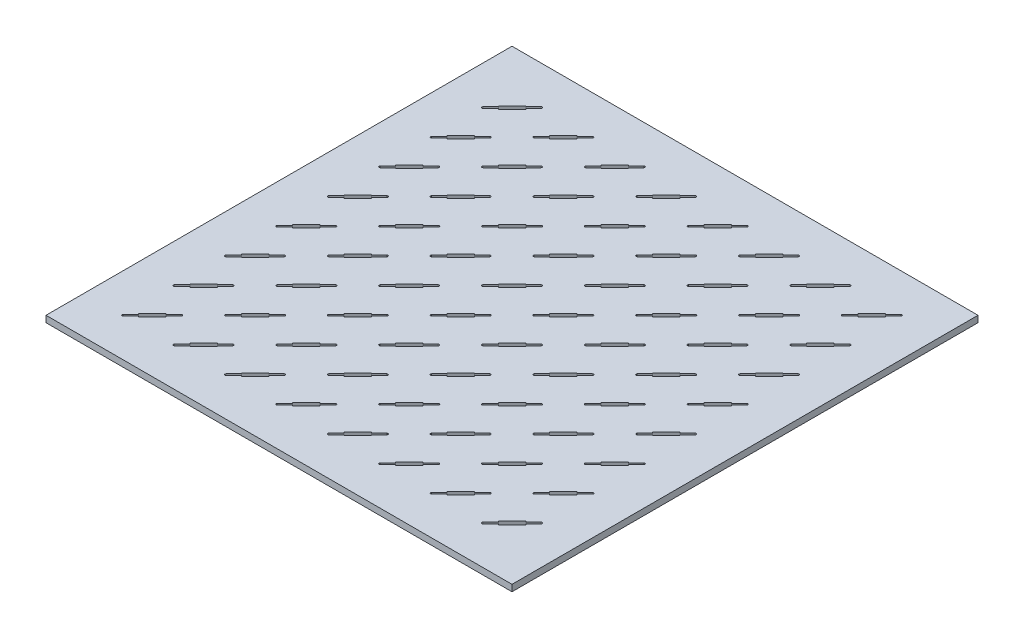
from build123d import *

# Parameters (mm, degrees)
SKETCH1_W           = 431.8
SKETCH1_H           = 431.8
BOSS_EXTRUDE1_DEPTH = 6
CUT_EXTRUDE1_DEPTH  = 4
SKETCH5_R           = 1
CUT_EXTRUDE3_DEPTH  = 611.68689195


with BuildPart() as part:
    # Sketch1 → Boss-Extrude1 (new body)
    with BuildSketch(Plane(origin=(0, 0, 0), x_dir=(1, 0, 0), z_dir=(0, 1, 0))):
        with Locations((215.9, 215.9)):
            Rectangle(SKETCH1_W, SKETCH1_H)
    extrude(amount=BOSS_EXTRUDE1_DEPTH)

    # Sketch2 → Cut-Extrude1 (cut)
    with BuildSketch(Plane(origin=(0, 6, 0), x_dir=(1, 0, 0), z_dir=(0, 1, 0))):
        Polygon((42.140753045, 43.554966607), (35.069685233, 36.483898795), (36.483898795, 35.069685233), (43.554966607, 42.140753045), (44.262073388, 41.433646263), (56.98999545, 54.161568325), (56.282888668, 54.868675106), (63.35395648, 61.939742918), (61.939742918, 63.35395648), (54.868675106, 56.282888668), (54.161568325, 56.98999545), (41.433646263, 44.262073388), align=None)
        Polygon((56.98999545, 101.791568325), (56.282888668, 102.498675106), (63.35395648, 109.569742918), (61.939742918, 110.98395648), (54.868675106, 103.912888668), (54.161568325, 104.61999545), (41.433646263, 91.892073388), (42.140753045, 91.184966607), (35.069685233, 84.113898795), (36.483898795, 82.699685233), (43.554966607, 89.770753045), (44.262073388, 89.063646263), align=None)
        Polygon((56.98999545, 149.421568325), (56.282888668, 150.128675106), (63.35395648, 157.199742918), (61.939742918, 158.61395648), (54.868675106, 151.542888668), (54.161568325, 152.24999545), (41.433646263, 139.522073388), (42.140753045, 138.814966607), (35.069685233, 131.743898795), (36.483898795, 130.329685233), (43.554966607, 137.400753045), (44.262073388, 136.693646263), align=None)
        Polygon((56.98999545, 197.051568325), (56.282888668, 197.758675106), (63.35395648, 204.829742918), (61.939742918, 206.24395648), (54.868675106, 199.172888668), (54.161568325, 199.87999545), (41.433646263, 187.152073388), (42.140753045, 186.444966607), (35.069685233, 179.373898795), (36.483898795, 177.959685233), (43.554966607, 185.030753045), (44.262073388, 184.323646263), align=None)
        Polygon((56.98999545, 244.681568325), (56.282888668, 245.388675106), (63.35395648, 252.459742918), (61.939742918, 253.87395648), (54.868675106, 246.802888668), (54.161568325, 247.50999545), (41.433646263, 234.782073388), (42.140753045, 234.074966607), (35.069685233, 227.003898795), (36.483898795, 225.589685233), (43.554966607, 232.660753045), (44.262073388, 231.953646263), align=None)
        Polygon((56.98999545, 292.311568325), (56.282888668, 293.018675106), (63.35395648, 300.089742918), (61.939742918, 301.50395648), (54.868675106, 294.432888668), (54.161568325, 295.13999545), (41.433646263, 282.412073388), (42.140753045, 281.704966607), (35.069685233, 274.633898795), (36.483898795, 273.219685233), (43.554966607, 280.290753045), (44.262073388, 279.583646263), align=None)
        Polygon((56.98999545, 339.941568325), (56.282888668, 340.648675106), (63.35395648, 347.719742918), (61.939742918, 349.13395648), (54.868675106, 342.062888668), (54.161568325, 342.76999545), (41.433646263, 330.042073388), (42.140753045, 329.334966607), (35.069685233, 322.263898795), (36.483898795, 320.849685233), (43.554966607, 327.920753045), (44.262073388, 327.213646263), align=None)
        Polygon((56.98999545, 387.571568325), (56.282888668, 388.278675106), (63.35395648, 395.349742918), (61.939742918, 396.76395648), (54.868675106, 389.692888668), (54.161568325, 390.39999545), (41.433646263, 377.672073388), (42.140753045, 376.964966607), (35.069685233, 369.893898795), (36.483898795, 368.479685233), (43.554966607, 375.550753045), (44.262073388, 374.843646263), align=None)
        Polygon((104.61999545, 101.791568325), (103.912888668, 102.498675106), (110.98395648, 109.569742918), (109.569742918, 110.98395648), (102.498675106, 103.912888668), (101.791568325, 104.61999545), (89.063646263, 91.892073388), (89.770753045, 91.184966607), (82.699685233, 84.113898795), (84.113898795, 82.699685233), (91.184966607, 89.770753045), (91.892073388, 89.063646263), align=None)
        Polygon((104.61999545, 149.421568325), (103.912888668, 150.128675106), (110.98395648, 157.199742918), (109.569742918, 158.61395648), (102.498675106, 151.542888668), (101.791568325, 152.24999545), (89.063646263, 139.522073388), (89.770753045, 138.814966607), (82.699685233, 131.743898795), (84.113898795, 130.329685233), (91.184966607, 137.400753045), (91.892073388, 136.693646263), align=None)
        Polygon((104.61999545, 197.051568325), (103.912888668, 197.758675106), (110.98395648, 204.829742918), (109.569742918, 206.24395648), (102.498675106, 199.172888668), (101.791568325, 199.87999545), (89.063646263, 187.152073388), (89.770753045, 186.444966607), (82.699685233, 179.373898795), (84.113898795, 177.959685233), (91.184966607, 185.030753045), (91.892073388, 184.323646263), align=None)
        Polygon((104.61999545, 244.681568325), (103.912888668, 245.388675106), (110.98395648, 252.459742918), (109.569742918, 253.87395648), (102.498675106, 246.802888668), (101.791568325, 247.50999545), (89.063646263, 234.782073388), (89.770753045, 234.074966607), (82.699685233, 227.003898795), (84.113898795, 225.589685233), (91.184966607, 232.660753045), (91.892073388, 231.953646263), align=None)
        Polygon((104.61999545, 292.311568325), (103.912888668, 293.018675106), (110.98395648, 300.089742918), (109.569742918, 301.50395648), (102.498675106, 294.432888668), (101.791568325, 295.13999545), (89.063646263, 282.412073388), (89.770753045, 281.704966607), (82.699685233, 274.633898795), (84.113898795, 273.219685233), (91.184966607, 280.290753045), (91.892073388, 279.583646263), align=None)
        Polygon((104.61999545, 339.941568325), (103.912888668, 340.648675106), (110.98395648, 347.719742918), (109.569742918, 349.13395648), (102.498675106, 342.062888668), (101.791568325, 342.76999545), (89.063646263, 330.042073388), (89.770753045, 329.334966607), (82.699685233, 322.263898795), (84.113898795, 320.849685233), (91.184966607, 327.920753045), (91.892073388, 327.213646263), align=None)
        Polygon((104.61999545, 387.571568325), (103.912888668, 388.278675106), (110.98395648, 395.349742918), (109.569742918, 396.76395648), (102.498675106, 389.692888668), (101.791568325, 390.39999545), (89.063646263, 377.672073388), (89.770753045, 376.964966607), (82.699685233, 369.893898795), (84.113898795, 368.479685233), (91.184966607, 375.550753045), (91.892073388, 374.843646263), align=None)
        Polygon((152.24999545, 101.791568325), (151.542888668, 102.498675106), (158.61395648, 109.569742918), (157.199742918, 110.98395648), (150.128675106, 103.912888668), (149.421568325, 104.61999545), (136.693646263, 91.892073388), (137.400753045, 91.184966607), (130.329685233, 84.113898795), (131.743898795, 82.699685233), (138.814966607, 89.770753045), (139.522073388, 89.063646263), align=None)
        Polygon((152.24999545, 149.421568325), (151.542888668, 150.128675106), (158.61395648, 157.199742918), (157.199742918, 158.61395648), (150.128675106, 151.542888668), (149.421568325, 152.24999545), (136.693646263, 139.522073388), (137.400753045, 138.814966607), (130.329685233, 131.743898795), (131.743898795, 130.329685233), (138.814966607, 137.400753045), (139.522073388, 136.693646263), align=None)
        Polygon((152.24999545, 197.051568325), (151.542888668, 197.758675106), (158.61395648, 204.829742918), (157.199742918, 206.24395648), (150.128675106, 199.172888668), (149.421568325, 199.87999545), (136.693646263, 187.152073388), (137.400753045, 186.444966607), (130.329685233, 179.373898795), (131.743898795, 177.959685233), (138.814966607, 185.030753045), (139.522073388, 184.323646263), align=None)
        Polygon((152.24999545, 244.681568325), (151.542888668, 245.388675106), (158.61395648, 252.459742918), (157.199742918, 253.87395648), (150.128675106, 246.802888668), (149.421568325, 247.50999545), (136.693646263, 234.782073388), (137.400753045, 234.074966607), (130.329685233, 227.003898795), (131.743898795, 225.589685233), (138.814966607, 232.660753045), (139.522073388, 231.953646263), align=None)
        Polygon((152.24999545, 292.311568325), (151.542888668, 293.018675106), (158.61395648, 300.089742918), (157.199742918, 301.50395648), (150.128675106, 294.432888668), (149.421568325, 295.13999545), (136.693646263, 282.412073388), (137.400753045, 281.704966607), (130.329685233, 274.633898795), (131.743898795, 273.219685233), (138.814966607, 280.290753045), (139.522073388, 279.583646263), align=None)
        Polygon((152.24999545, 339.941568325), (151.542888668, 340.648675106), (158.61395648, 347.719742918), (157.199742918, 349.13395648), (150.128675106, 342.062888668), (149.421568325, 342.76999545), (136.693646263, 330.042073388), (137.400753045, 329.334966607), (130.329685233, 322.263898795), (131.743898795, 320.849685233), (138.814966607, 327.920753045), (139.522073388, 327.213646263), align=None)
        Polygon((152.24999545, 387.571568325), (151.542888668, 388.278675106), (158.61395648, 395.349742918), (157.199742918, 396.76395648), (150.128675106, 389.692888668), (149.421568325, 390.39999545), (136.693646263, 377.672073388), (137.400753045, 376.964966607), (130.329685233, 369.893898795), (131.743898795, 368.479685233), (138.814966607, 375.550753045), (139.522073388, 374.843646263), align=None)
        Polygon((199.87999545, 101.791568325), (199.172888668, 102.498675106), (206.24395648, 109.569742918), (204.829742918, 110.98395648), (197.758675106, 103.912888668), (197.051568325, 104.61999545), (184.323646263, 91.892073388), (185.030753045, 91.184966607), (177.959685233, 84.113898795), (179.373898795, 82.699685233), (186.444966607, 89.770753045), (187.152073388, 89.063646263), align=None)
        Polygon((199.87999545, 149.421568325), (199.172888668, 150.128675106), (206.24395648, 157.199742918), (204.829742918, 158.61395648), (197.758675106, 151.542888668), (197.051568325, 152.24999545), (184.323646263, 139.522073388), (185.030753045, 138.814966607), (177.959685233, 131.743898795), (179.373898795, 130.329685233), (186.444966607, 137.400753045), (187.152073388, 136.693646263), align=None)
        Polygon((199.87999545, 197.051568325), (199.172888668, 197.758675106), (206.24395648, 204.829742918), (204.829742918, 206.24395648), (197.758675106, 199.172888668), (197.051568325, 199.87999545), (184.323646263, 187.152073388), (185.030753045, 186.444966607), (177.959685233, 179.373898795), (179.373898795, 177.959685233), (186.444966607, 185.030753045), (187.152073388, 184.323646263), align=None)
        Polygon((199.87999545, 244.681568325), (199.172888668, 245.388675106), (206.24395648, 252.459742918), (204.829742918, 253.87395648), (197.758675106, 246.802888668), (197.051568325, 247.50999545), (184.323646263, 234.782073388), (185.030753045, 234.074966607), (177.959685233, 227.003898795), (179.373898795, 225.589685233), (186.444966607, 232.660753045), (187.152073388, 231.953646263), align=None)
        Polygon((199.87999545, 292.311568325), (199.172888668, 293.018675106), (206.24395648, 300.089742918), (204.829742918, 301.50395648), (197.758675106, 294.432888668), (197.051568325, 295.13999545), (184.323646263, 282.412073388), (185.030753045, 281.704966607), (177.959685233, 274.633898795), (179.373898795, 273.219685233), (186.444966607, 280.290753045), (187.152073388, 279.583646263), align=None)
        Polygon((199.87999545, 339.941568325), (199.172888668, 340.648675106), (206.24395648, 347.719742918), (204.829742918, 349.13395648), (197.758675106, 342.062888668), (197.051568325, 342.76999545), (184.323646263, 330.042073388), (185.030753045, 329.334966607), (177.959685233, 322.263898795), (179.373898795, 320.849685233), (186.444966607, 327.920753045), (187.152073388, 327.213646263), align=None)
        Polygon((199.87999545, 387.571568325), (199.172888668, 388.278675106), (206.24395648, 395.349742918), (204.829742918, 396.76395648), (197.758675106, 389.692888668), (197.051568325, 390.39999545), (184.323646263, 377.672073388), (185.030753045, 376.964966607), (177.959685233, 369.893898795), (179.373898795, 368.479685233), (186.444966607, 375.550753045), (187.152073388, 374.843646263), align=None)
        Polygon((247.50999545, 101.791568325), (246.802888668, 102.498675106), (253.87395648, 109.569742918), (252.459742918, 110.98395648), (245.388675106, 103.912888668), (244.681568325, 104.61999545), (231.953646263, 91.892073388), (232.660753045, 91.184966607), (225.589685233, 84.113898795), (227.003898795, 82.699685233), (234.074966607, 89.770753045), (234.782073388, 89.063646263), align=None)
        Polygon((247.50999545, 149.421568325), (246.802888668, 150.128675106), (253.87395648, 157.199742918), (252.459742918, 158.61395648), (245.388675106, 151.542888668), (244.681568325, 152.24999545), (231.953646263, 139.522073388), (232.660753045, 138.814966607), (225.589685233, 131.743898795), (227.003898795, 130.329685233), (234.074966607, 137.400753045), (234.782073388, 136.693646263), align=None)
        Polygon((247.50999545, 197.051568325), (246.802888668, 197.758675106), (253.87395648, 204.829742918), (252.459742918, 206.24395648), (245.388675106, 199.172888668), (244.681568325, 199.87999545), (231.953646263, 187.152073388), (232.660753045, 186.444966607), (225.589685233, 179.373898795), (227.003898795, 177.959685233), (234.074966607, 185.030753045), (234.782073388, 184.323646263), align=None)
        Polygon((247.50999545, 244.681568325), (246.802888668, 245.388675106), (253.87395648, 252.459742918), (252.459742918, 253.87395648), (245.388675106, 246.802888668), (244.681568325, 247.50999545), (231.953646263, 234.782073388), (232.660753045, 234.074966607), (225.589685233, 227.003898795), (227.003898795, 225.589685233), (234.074966607, 232.660753045), (234.782073388, 231.953646263), align=None)
        Polygon((247.50999545, 292.311568325), (246.802888668, 293.018675106), (253.87395648, 300.089742918), (252.459742918, 301.50395648), (245.388675106, 294.432888668), (244.681568325, 295.13999545), (231.953646263, 282.412073388), (232.660753045, 281.704966607), (225.589685233, 274.633898795), (227.003898795, 273.219685233), (234.074966607, 280.290753045), (234.782073388, 279.583646263), align=None)
        Polygon((247.50999545, 339.941568325), (246.802888668, 340.648675106), (253.87395648, 347.719742918), (252.459742918, 349.13395648), (245.388675106, 342.062888668), (244.681568325, 342.76999545), (231.953646263, 330.042073388), (232.660753045, 329.334966607), (225.589685233, 322.263898795), (227.003898795, 320.849685233), (234.074966607, 327.920753045), (234.782073388, 327.213646263), align=None)
        Polygon((247.50999545, 387.571568325), (246.802888668, 388.278675106), (253.87395648, 395.349742918), (252.459742918, 396.76395648), (245.388675106, 389.692888668), (244.681568325, 390.39999545), (231.953646263, 377.672073388), (232.660753045, 376.964966607), (225.589685233, 369.893898795), (227.003898795, 368.479685233), (234.074966607, 375.550753045), (234.782073388, 374.843646263), align=None)
        Polygon((295.13999545, 101.791568325), (294.432888668, 102.498675106), (301.50395648, 109.569742918), (300.089742918, 110.98395648), (293.018675106, 103.912888668), (292.311568325, 104.61999545), (279.583646263, 91.892073388), (280.290753045, 91.184966607), (273.219685233, 84.113898795), (274.633898795, 82.699685233), (281.704966607, 89.770753045), (282.412073388, 89.063646263), align=None)
        Polygon((295.13999545, 149.421568325), (294.432888668, 150.128675106), (301.50395648, 157.199742918), (300.089742918, 158.61395648), (293.018675106, 151.542888668), (292.311568325, 152.24999545), (279.583646263, 139.522073388), (280.290753045, 138.814966607), (273.219685233, 131.743898795), (274.633898795, 130.329685233), (281.704966607, 137.400753045), (282.412073388, 136.693646263), align=None)
        Polygon((295.13999545, 197.051568325), (294.432888668, 197.758675106), (301.50395648, 204.829742918), (300.089742918, 206.24395648), (293.018675106, 199.172888668), (292.311568325, 199.87999545), (279.583646263, 187.152073388), (280.290753045, 186.444966607), (273.219685233, 179.373898795), (274.633898795, 177.959685233), (281.704966607, 185.030753045), (282.412073388, 184.323646263), align=None)
        Polygon((295.13999545, 244.681568325), (294.432888668, 245.388675106), (301.50395648, 252.459742918), (300.089742918, 253.87395648), (293.018675106, 246.802888668), (292.311568325, 247.50999545), (279.583646263, 234.782073388), (280.290753045, 234.074966607), (273.219685233, 227.003898795), (274.633898795, 225.589685233), (281.704966607, 232.660753045), (282.412073388, 231.953646263), align=None)
        Polygon((295.13999545, 292.311568325), (294.432888668, 293.018675106), (301.50395648, 300.089742918), (300.089742918, 301.50395648), (293.018675106, 294.432888668), (292.311568325, 295.13999545), (279.583646263, 282.412073388), (280.290753045, 281.704966607), (273.219685233, 274.633898795), (274.633898795, 273.219685233), (281.704966607, 280.290753045), (282.412073388, 279.583646263), align=None)
        Polygon((295.13999545, 339.941568325), (294.432888668, 340.648675106), (301.50395648, 347.719742918), (300.089742918, 349.13395648), (293.018675106, 342.062888668), (292.311568325, 342.76999545), (279.583646263, 330.042073388), (280.290753045, 329.334966607), (273.219685233, 322.263898795), (274.633898795, 320.849685233), (281.704966607, 327.920753045), (282.412073388, 327.213646263), align=None)
        Polygon((295.13999545, 387.571568325), (294.432888668, 388.278675106), (301.50395648, 395.349742918), (300.089742918, 396.76395648), (293.018675106, 389.692888668), (292.311568325, 390.39999545), (279.583646263, 377.672073388), (280.290753045, 376.964966607), (273.219685233, 369.893898795), (274.633898795, 368.479685233), (281.704966607, 375.550753045), (282.412073388, 374.843646263), align=None)
        Polygon((342.76999545, 101.791568325), (342.062888668, 102.498675106), (349.13395648, 109.569742918), (347.719742918, 110.98395648), (340.648675106, 103.912888668), (339.941568325, 104.61999545), (327.213646263, 91.892073388), (327.920753045, 91.184966607), (320.849685233, 84.113898795), (322.263898795, 82.699685233), (329.334966607, 89.770753045), (330.042073388, 89.063646263), align=None)
        Polygon((342.76999545, 149.421568325), (342.062888668, 150.128675106), (349.13395648, 157.199742918), (347.719742918, 158.61395648), (340.648675106, 151.542888668), (339.941568325, 152.24999545), (327.213646263, 139.522073388), (327.920753045, 138.814966607), (320.849685233, 131.743898795), (322.263898795, 130.329685233), (329.334966607, 137.400753045), (330.042073388, 136.693646263), align=None)
        Polygon((342.76999545, 197.051568325), (342.062888668, 197.758675106), (349.13395648, 204.829742918), (347.719742918, 206.24395648), (340.648675106, 199.172888668), (339.941568325, 199.87999545), (327.213646263, 187.152073388), (327.920753045, 186.444966607), (320.849685233, 179.373898795), (322.263898795, 177.959685233), (329.334966607, 185.030753045), (330.042073388, 184.323646263), align=None)
        Polygon((342.76999545, 244.681568325), (342.062888668, 245.388675106), (349.13395648, 252.459742918), (347.719742918, 253.87395648), (340.648675106, 246.802888668), (339.941568325, 247.50999545), (327.213646263, 234.782073388), (327.920753045, 234.074966607), (320.849685233, 227.003898795), (322.263898795, 225.589685233), (329.334966607, 232.660753045), (330.042073388, 231.953646263), align=None)
        Polygon((342.76999545, 292.311568325), (342.062888668, 293.018675106), (349.13395648, 300.089742918), (347.719742918, 301.50395648), (340.648675106, 294.432888668), (339.941568325, 295.13999545), (327.213646263, 282.412073388), (327.920753045, 281.704966607), (320.849685233, 274.633898795), (322.263898795, 273.219685233), (329.334966607, 280.290753045), (330.042073388, 279.583646263), align=None)
        Polygon((342.76999545, 339.941568325), (342.062888668, 340.648675106), (349.13395648, 347.719742918), (347.719742918, 349.13395648), (340.648675106, 342.062888668), (339.941568325, 342.76999545), (327.213646263, 330.042073388), (327.920753045, 329.334966607), (320.849685233, 322.263898795), (322.263898795, 320.849685233), (329.334966607, 327.920753045), (330.042073388, 327.213646263), align=None)
        Polygon((342.76999545, 387.571568325), (342.062888668, 388.278675106), (349.13395648, 395.349742918), (347.719742918, 396.76395648), (340.648675106, 389.692888668), (339.941568325, 390.39999545), (327.213646263, 377.672073388), (327.920753045, 376.964966607), (320.849685233, 369.893898795), (322.263898795, 368.479685233), (329.334966607, 375.550753045), (330.042073388, 374.843646263), align=None)
        Polygon((390.39999545, 101.791568325), (389.692888668, 102.498675106), (396.76395648, 109.569742918), (395.349742918, 110.98395648), (388.278675106, 103.912888668), (387.571568325, 104.61999545), (374.843646263, 91.892073388), (375.550753045, 91.184966607), (368.479685233, 84.113898795), (369.893898795, 82.699685233), (376.964966607, 89.770753045), (377.672073388, 89.063646263), align=None)
        Polygon((390.39999545, 149.421568325), (389.692888668, 150.128675106), (396.76395648, 157.199742918), (395.349742918, 158.61395648), (388.278675106, 151.542888668), (387.571568325, 152.24999545), (374.843646263, 139.522073388), (375.550753045, 138.814966607), (368.479685233, 131.743898795), (369.893898795, 130.329685233), (376.964966607, 137.400753045), (377.672073388, 136.693646263), align=None)
        Polygon((390.39999545, 197.051568325), (389.692888668, 197.758675106), (396.76395648, 204.829742918), (395.349742918, 206.24395648), (388.278675106, 199.172888668), (387.571568325, 199.87999545), (374.843646263, 187.152073388), (375.550753045, 186.444966607), (368.479685233, 179.373898795), (369.893898795, 177.959685233), (376.964966607, 185.030753045), (377.672073388, 184.323646263), align=None)
        Polygon((390.39999545, 244.681568325), (389.692888668, 245.388675106), (396.76395648, 252.459742918), (395.349742918, 253.87395648), (388.278675106, 246.802888668), (387.571568325, 247.50999545), (374.843646263, 234.782073388), (375.550753045, 234.074966607), (368.479685233, 227.003898795), (369.893898795, 225.589685233), (376.964966607, 232.660753045), (377.672073388, 231.953646263), align=None)
        Polygon((390.39999545, 292.311568325), (389.692888668, 293.018675106), (396.76395648, 300.089742918), (395.349742918, 301.50395648), (388.278675106, 294.432888668), (387.571568325, 295.13999545), (374.843646263, 282.412073388), (375.550753045, 281.704966607), (368.479685233, 274.633898795), (369.893898795, 273.219685233), (376.964966607, 280.290753045), (377.672073388, 279.583646263), align=None)
        Polygon((390.39999545, 339.941568325), (389.692888668, 340.648675106), (396.76395648, 347.719742918), (395.349742918, 349.13395648), (388.278675106, 342.062888668), (387.571568325, 342.76999545), (374.843646263, 330.042073388), (375.550753045, 329.334966607), (368.479685233, 322.263898795), (369.893898795, 320.849685233), (376.964966607, 327.920753045), (377.672073388, 327.213646263), align=None)
        Polygon((390.39999545, 387.571568325), (389.692888668, 388.278675106), (396.76395648, 395.349742918), (395.349742918, 396.76395648), (388.278675106, 389.692888668), (387.571568325, 390.39999545), (374.843646263, 377.672073388), (375.550753045, 376.964966607), (368.479685233, 369.893898795), (369.893898795, 368.479685233), (376.964966607, 375.550753045), (377.672073388, 374.843646263), align=None)
        Polygon((104.61999545, 54.161568325), (103.912888668, 54.868675106), (110.98395648, 61.939742918), (109.569742918, 63.35395648), (102.498675106, 56.282888668), (101.791568325, 56.98999545), (89.063646263, 44.262073388), (89.770753045, 43.554966607), (82.699685233, 36.483898795), (84.113898795, 35.069685233), (91.184966607, 42.140753045), (91.892073388, 41.433646263), align=None)
        Polygon((152.24999545, 54.161568325), (151.542888668, 54.868675106), (158.61395648, 61.939742918), (157.199742918, 63.35395648), (150.128675106, 56.282888668), (149.421568325, 56.98999545), (136.693646263, 44.262073388), (137.400753045, 43.554966607), (130.329685233, 36.483898795), (131.743898795, 35.069685233), (138.814966607, 42.140753045), (139.522073388, 41.433646263), align=None)
        Polygon((199.87999545, 54.161568325), (199.172888668, 54.868675106), (206.24395648, 61.939742918), (204.829742918, 63.35395648), (197.758675106, 56.282888668), (197.051568325, 56.98999545), (184.323646263, 44.262073388), (185.030753045, 43.554966607), (177.959685233, 36.483898795), (179.373898795, 35.069685233), (186.444966607, 42.140753045), (187.152073388, 41.433646263), align=None)
        Polygon((247.50999545, 54.161568325), (246.802888668, 54.868675106), (253.87395648, 61.939742918), (252.459742918, 63.35395648), (245.388675106, 56.282888668), (244.681568325, 56.98999545), (231.953646263, 44.262073388), (232.660753045, 43.554966607), (225.589685233, 36.483898795), (227.003898795, 35.069685233), (234.074966607, 42.140753045), (234.782073388, 41.433646263), align=None)
        Polygon((295.13999545, 54.161568325), (294.432888668, 54.868675106), (301.50395648, 61.939742918), (300.089742918, 63.35395648), (293.018675106, 56.282888668), (292.311568325, 56.98999545), (279.583646263, 44.262073388), (280.290753045, 43.554966607), (273.219685233, 36.483898795), (274.633898795, 35.069685233), (281.704966607, 42.140753045), (282.412073388, 41.433646263), align=None)
        Polygon((342.76999545, 54.161568325), (342.062888668, 54.868675106), (349.13395648, 61.939742918), (347.719742918, 63.35395648), (340.648675106, 56.282888668), (339.941568325, 56.98999545), (327.213646263, 44.262073388), (327.920753045, 43.554966607), (320.849685233, 36.483898795), (322.263898795, 35.069685233), (329.334966607, 42.140753045), (330.042073388, 41.433646263), align=None)
        Polygon((390.39999545, 54.161568325), (389.692888668, 54.868675106), (396.76395648, 61.939742918), (395.349742918, 63.35395648), (388.278675106, 56.282888668), (387.571568325, 56.98999545), (374.843646263, 44.262073388), (375.550753045, 43.554966607), (368.479685233, 36.483898795), (369.893898795, 35.069685233), (376.964966607, 42.140753045), (377.672073388, 41.433646263), align=None)
    extrude(amount=-CUT_EXTRUDE1_DEPTH, mode=Mode.SUBTRACT)

    # Sketch5 → Cut-Extrude3 (cut, through all)
    with BuildSketch(Plane(origin=(0, 6, 0), x_dir=(1, 0, 0), z_dir=(0, 1, 0))):
        with Locations((35.776792014, 35.776792014)):
            Circle(SKETCH5_R)
        with Locations((62.646849699, 62.646849699)):
            Circle(SKETCH5_R)
        with Locations((35.776792014, 83.406792014)):
            Circle(SKETCH5_R)
        with Locations((62.646849699, 110.276849699)):
            Circle(SKETCH5_R)
        with Locations((35.776792014, 131.036792014)):
            Circle(SKETCH5_R)
        with Locations((62.646849699, 157.906849699)):
            Circle(SKETCH5_R)
        with Locations((35.776792014, 178.666792014)):
            Circle(SKETCH5_R)
        with Locations((62.646849699, 205.536849699)):
            Circle(SKETCH5_R)
        with Locations((35.776792014, 226.296792014)):
            Circle(SKETCH5_R)
        with Locations((62.646849699, 253.166849699)):
            Circle(SKETCH5_R)
        with Locations((35.776792014, 273.926792014)):
            Circle(SKETCH5_R)
        with Locations((62.646849699, 300.796849699)):
            Circle(SKETCH5_R)
        with Locations((35.776792014, 321.556792014)):
            Circle(SKETCH5_R)
        with Locations((62.646849699, 348.426849699)):
            Circle(SKETCH5_R)
        with Locations((35.776792014, 369.186792014)):
            Circle(SKETCH5_R)
        with Locations((62.646849699, 396.056849699)):
            Circle(SKETCH5_R)
        with Locations((83.406792014, 83.406792014)):
            Circle(SKETCH5_R)
        with Locations((110.276849699, 110.276849699)):
            Circle(SKETCH5_R)
        with Locations((83.406792014, 131.036792014)):
            Circle(SKETCH5_R)
        with Locations((110.276849699, 157.906849699)):
            Circle(SKETCH5_R)
        with Locations((83.406792014, 178.666792014)):
            Circle(SKETCH5_R)
        with Locations((110.276849699, 205.536849699)):
            Circle(SKETCH5_R)
        with Locations((83.406792014, 226.296792014)):
            Circle(SKETCH5_R)
        with Locations((110.276849699, 253.166849699)):
            Circle(SKETCH5_R)
        with Locations((83.406792014, 273.926792014)):
            Circle(SKETCH5_R)
        with Locations((110.276849699, 300.796849699)):
            Circle(SKETCH5_R)
        with Locations((83.406792014, 321.556792014)):
            Circle(SKETCH5_R)
        with Locations((110.276849699, 348.426849699)):
            Circle(SKETCH5_R)
        with Locations((83.406792014, 369.186792014)):
            Circle(SKETCH5_R)
        with Locations((110.276849699, 396.056849699)):
            Circle(SKETCH5_R)
        with Locations((131.036792014, 83.406792014)):
            Circle(SKETCH5_R)
        with Locations((157.906849699, 110.276849699)):
            Circle(SKETCH5_R)
        with Locations((131.036792014, 131.036792014)):
            Circle(SKETCH5_R)
        with Locations((157.906849699, 157.906849699)):
            Circle(SKETCH5_R)
        with Locations((131.036792014, 178.666792014)):
            Circle(SKETCH5_R)
        with Locations((157.906849699, 205.536849699)):
            Circle(SKETCH5_R)
        with Locations((131.036792014, 226.296792014)):
            Circle(SKETCH5_R)
        with Locations((157.906849699, 253.166849699)):
            Circle(SKETCH5_R)
        with Locations((131.036792014, 273.926792014)):
            Circle(SKETCH5_R)
        with Locations((157.906849699, 300.796849699)):
            Circle(SKETCH5_R)
        with Locations((131.036792014, 321.556792014)):
            Circle(SKETCH5_R)
        with Locations((157.906849699, 348.426849699)):
            Circle(SKETCH5_R)
        with Locations((131.036792014, 369.186792014)):
            Circle(SKETCH5_R)
        with Locations((157.906849699, 396.056849699)):
            Circle(SKETCH5_R)
        with Locations((178.666792014, 83.406792014)):
            Circle(SKETCH5_R)
        with Locations((205.536849699, 110.276849699)):
            Circle(SKETCH5_R)
        with Locations((178.666792014, 131.036792014)):
            Circle(SKETCH5_R)
        with Locations((205.536849699, 157.906849699)):
            Circle(SKETCH5_R)
        with Locations((178.666792014, 178.666792014)):
            Circle(SKETCH5_R)
        with Locations((205.536849699, 205.536849699)):
            Circle(SKETCH5_R)
        with Locations((178.666792014, 226.296792014)):
            Circle(SKETCH5_R)
        with Locations((205.536849699, 253.166849699)):
            Circle(SKETCH5_R)
        with Locations((178.666792014, 273.926792014)):
            Circle(SKETCH5_R)
        with Locations((205.536849699, 300.796849699)):
            Circle(SKETCH5_R)
        with Locations((178.666792014, 321.556792014)):
            Circle(SKETCH5_R)
        with Locations((205.536849699, 348.426849699)):
            Circle(SKETCH5_R)
        with Locations((178.666792014, 369.186792014)):
            Circle(SKETCH5_R)
        with Locations((205.536849699, 396.056849699)):
            Circle(SKETCH5_R)
        with Locations((226.296792014, 83.406792014)):
            Circle(SKETCH5_R)
        with Locations((253.166849699, 110.276849699)):
            Circle(SKETCH5_R)
        with Locations((226.296792014, 131.036792014)):
            Circle(SKETCH5_R)
        with Locations((253.166849699, 157.906849699)):
            Circle(SKETCH5_R)
        with Locations((226.296792014, 178.666792014)):
            Circle(SKETCH5_R)
        with Locations((253.166849699, 205.536849699)):
            Circle(SKETCH5_R)
        with Locations((226.296792014, 226.296792014)):
            Circle(SKETCH5_R)
        with Locations((253.166849699, 253.166849699)):
            Circle(SKETCH5_R)
        with Locations((226.296792014, 273.926792014)):
            Circle(SKETCH5_R)
        with Locations((253.166849699, 300.796849699)):
            Circle(SKETCH5_R)
        with Locations((226.296792014, 321.556792014)):
            Circle(SKETCH5_R)
        with Locations((253.166849699, 348.426849699)):
            Circle(SKETCH5_R)
        with Locations((226.296792014, 369.186792014)):
            Circle(SKETCH5_R)
        with Locations((253.166849699, 396.056849699)):
            Circle(SKETCH5_R)
        with Locations((273.926792014, 83.406792014)):
            Circle(SKETCH5_R)
        with Locations((300.796849699, 110.276849699)):
            Circle(SKETCH5_R)
        with Locations((273.926792014, 131.036792014)):
            Circle(SKETCH5_R)
        with Locations((300.796849699, 157.906849699)):
            Circle(SKETCH5_R)
        with Locations((273.926792014, 178.666792014)):
            Circle(SKETCH5_R)
        with Locations((300.796849699, 205.536849699)):
            Circle(SKETCH5_R)
        with Locations((273.926792014, 226.296792014)):
            Circle(SKETCH5_R)
        with Locations((300.796849699, 253.166849699)):
            Circle(SKETCH5_R)
        with Locations((273.926792014, 273.926792014)):
            Circle(SKETCH5_R)
        with Locations((300.796849699, 300.796849699)):
            Circle(SKETCH5_R)
        with Locations((273.926792014, 321.556792014)):
            Circle(SKETCH5_R)
        with Locations((300.796849699, 348.426849699)):
            Circle(SKETCH5_R)
        with Locations((273.926792014, 369.186792014)):
            Circle(SKETCH5_R)
        with Locations((300.796849699, 396.056849699)):
            Circle(SKETCH5_R)
        with Locations((321.556792014, 83.406792014)):
            Circle(SKETCH5_R)
        with Locations((348.426849699, 110.276849699)):
            Circle(SKETCH5_R)
        with Locations((321.556792014, 131.036792014)):
            Circle(SKETCH5_R)
        with Locations((348.426849699, 157.906849699)):
            Circle(SKETCH5_R)
        with Locations((321.556792014, 178.666792014)):
            Circle(SKETCH5_R)
        with Locations((348.426849699, 205.536849699)):
            Circle(SKETCH5_R)
        with Locations((321.556792014, 226.296792014)):
            Circle(SKETCH5_R)
        with Locations((348.426849699, 253.166849699)):
            Circle(SKETCH5_R)
        with Locations((321.556792014, 273.926792014)):
            Circle(SKETCH5_R)
        with Locations((348.426849699, 300.796849699)):
            Circle(SKETCH5_R)
        with Locations((321.556792014, 321.556792014)):
            Circle(SKETCH5_R)
        with Locations((348.426849699, 348.426849699)):
            Circle(SKETCH5_R)
        with Locations((321.556792014, 369.186792014)):
            Circle(SKETCH5_R)
        with Locations((348.426849699, 396.056849699)):
            Circle(SKETCH5_R)
        with Locations((369.186792014, 83.406792014)):
            Circle(SKETCH5_R)
        with Locations((396.056849699, 110.276849699)):
            Circle(SKETCH5_R)
        with Locations((369.186792014, 131.036792014)):
            Circle(SKETCH5_R)
        with Locations((396.056849699, 157.906849699)):
            Circle(SKETCH5_R)
        with Locations((369.186792014, 178.666792014)):
            Circle(SKETCH5_R)
        with Locations((396.056849699, 205.536849699)):
            Circle(SKETCH5_R)
        with Locations((369.186792014, 226.296792014)):
            Circle(SKETCH5_R)
        with Locations((396.056849699, 253.166849699)):
            Circle(SKETCH5_R)
        with Locations((369.186792014, 273.926792014)):
            Circle(SKETCH5_R)
        with Locations((396.056849699, 300.796849699)):
            Circle(SKETCH5_R)
        with Locations((369.186792014, 321.556792014)):
            Circle(SKETCH5_R)
        with Locations((396.056849699, 348.426849699)):
            Circle(SKETCH5_R)
        with Locations((369.186792014, 369.186792014)):
            Circle(SKETCH5_R)
        with Locations((396.056849699, 396.056849699)):
            Circle(SKETCH5_R)
        with Locations((83.406792014, 35.776792014)):
            Circle(SKETCH5_R)
        with Locations((110.276849699, 62.646849699)):
            Circle(SKETCH5_R)
        with Locations((131.036792014, 35.776792014)):
            Circle(SKETCH5_R)
        with Locations((157.906849699, 62.646849699)):
            Circle(SKETCH5_R)
        with Locations((178.666792014, 35.776792014)):
            Circle(SKETCH5_R)
        with Locations((205.536849699, 62.646849699)):
            Circle(SKETCH5_R)
        with Locations((226.296792014, 35.776792014)):
            Circle(SKETCH5_R)
        with Locations((253.166849699, 62.646849699)):
            Circle(SKETCH5_R)
        with Locations((273.926792014, 35.776792014)):
            Circle(SKETCH5_R)
        with Locations((300.796849699, 62.646849699)):
            Circle(SKETCH5_R)
        with Locations((321.556792014, 35.776792014)):
            Circle(SKETCH5_R)
        with Locations((348.426849699, 62.646849699)):
            Circle(SKETCH5_R)
        with Locations((369.186792014, 35.776792014)):
            Circle(SKETCH5_R)
        with Locations((396.056849699, 62.646849699)):
            Circle(SKETCH5_R)
    extrude(amount=-CUT_EXTRUDE3_DEPTH, mode=Mode.SUBTRACT)


solid = part.part
